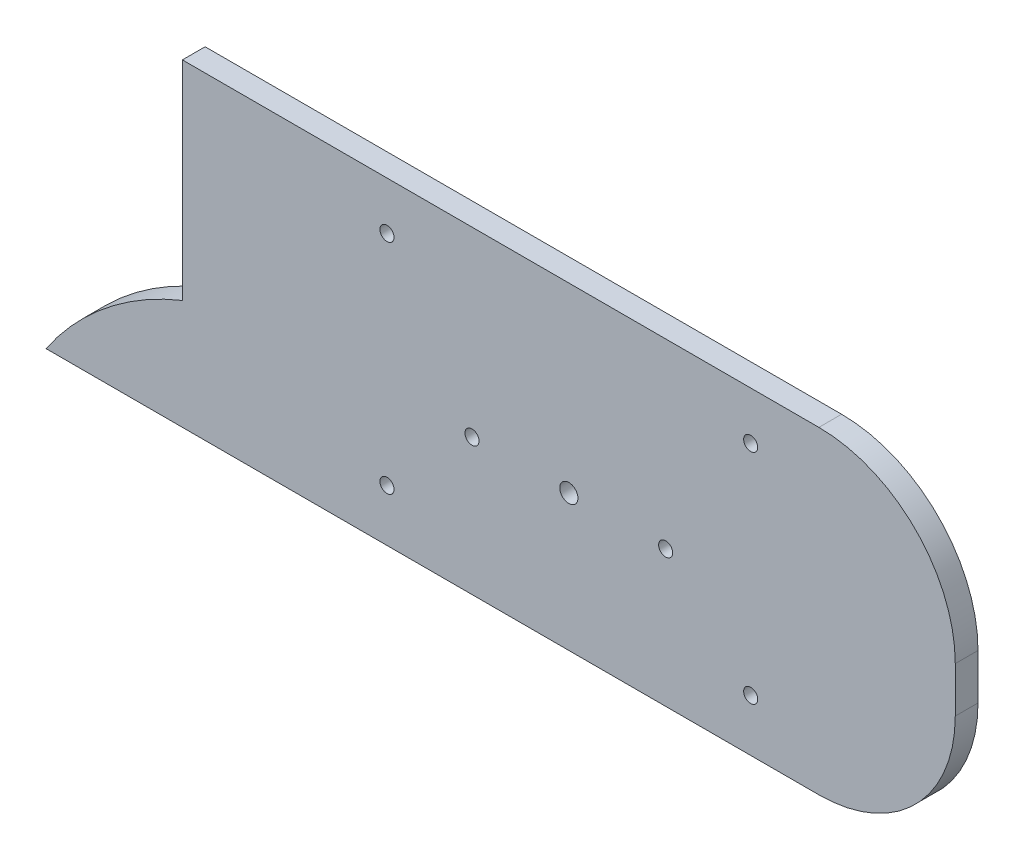
from build123d import *

# Parameters (mm, degrees)
BOSS_EXTRUDE1_DEPTH = 12.7
SKETCH3_R           = 3.937
CUT_EXTRUDE1_DEPTH  = 539.366167213
SKETCH4_R           = 5.08
SKETCH4_R_2         = 3.937
CUT_EXTRUDE2_DEPTH  = 539.366167213


with BuildPart() as part:
    # Sketch2 → Boss-Extrude1 (new body)
    with BuildSketch(Plane.XY):
        with BuildLine():
            Line((0, 0), (431.8, 0))
            ThreePointArc((431.8, 0), (485.681536726, 22.318463274), (508, 76.2))
            Line((508, 76.2), (508, 101.6))
            ThreePointArc((508, 101.6), (485.681536726, 155.481536726), (431.8, 177.8))
            Line((431.8, 177.8), (152.4, 177.8))
            Line((152.4, 177.8), (76.2, 177.8))
            Line((76.2, 177.8), (76.2, 61.401251199))
            ThreePointArc((76.2, 61.401251199), (33.506060073, 36.401783403), (0, 0))
        make_face()
    extrude(amount=BOSS_EXTRUDE1_DEPTH)

    # Sketch3 → Cut-Extrude1 (cut, through all)
    with BuildSketch(Plane(origin=(0, 0, 0), x_dir=(-1, 0, 0), z_dir=(0, 0, -1))):
        with Locations((-190.5, 29.082055279)):
            Circle(SKETCH3_R)
        with Locations((-393.7, 29.082055279)):
            Circle(SKETCH3_R)
        with Locations((-393.7, 151.002055279)):
            Circle(SKETCH3_R)
        with Locations((-190.5, 151.002055279)):
            Circle(SKETCH3_R)
    extrude(amount=-CUT_EXTRUDE1_DEPTH, mode=Mode.SUBTRACT)

    # Sketch4 → Cut-Extrude2 (cut, through all)
    with BuildSketch(Plane.XY.offset(12.7)):
        with Locations((292.1, 76.2)):
            Circle(SKETCH4_R)
        with Locations((237.998, 76.2)):
            Circle(SKETCH4_R_2)
        with Locations((346.202, 76.2)):
            Circle(SKETCH4_R_2)
    extrude(amount=-CUT_EXTRUDE2_DEPTH, mode=Mode.SUBTRACT)


solid = part.part
